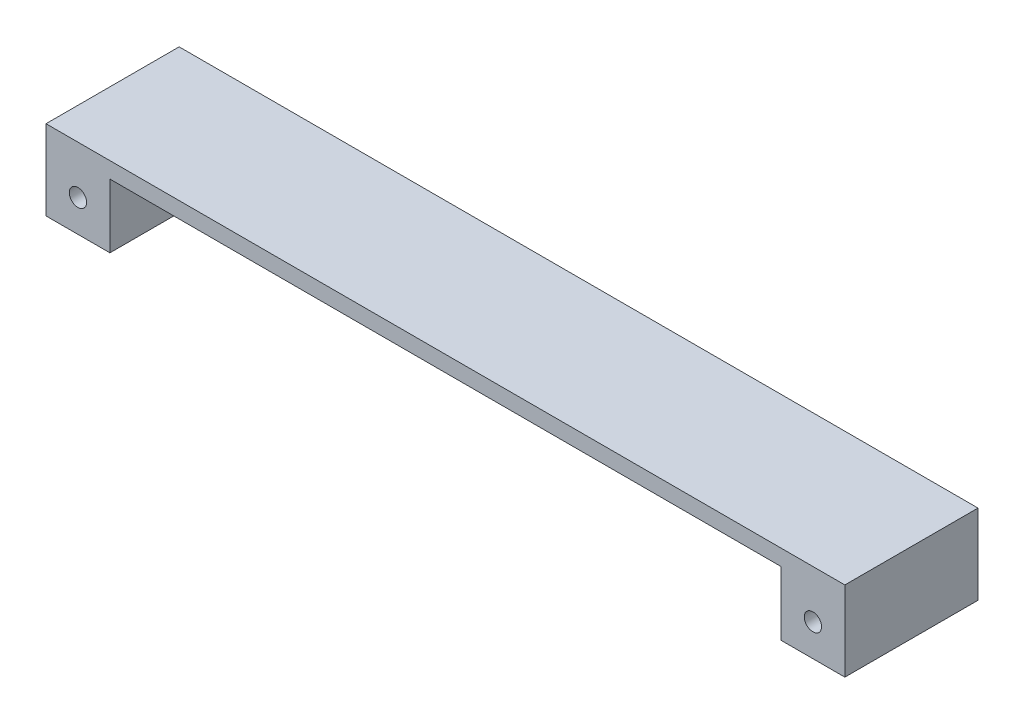
from build123d import *

# Parameters (mm, degrees)
SKETCH1_W           = 150
SKETCH1_H           = 25
BOSS_EXTRUDE1_DEPTH = 3
SKETCH2_W           = 12
SKETCH2_H           = 25
BOSS_EXTRUDE2_DEPTH = 12
SKETCH4_R           = 1.625
CUT_EXTRUDE1_DEPTH  = 153.541797551


with BuildPart() as part:
    # Sketch1 → Boss-Extrude1 (new body)
    with BuildSketch(Plane(origin=(0, 0, 0), x_dir=(1, 0, 0), z_dir=(0, 1, 0))):
        with Locations((75, 12.5)):
            Rectangle(SKETCH1_W, SKETCH1_H)
    extrude(amount=BOSS_EXTRUDE1_DEPTH)

    # Sketch2 → Boss-Extrude2 (add)
    with BuildSketch(Plane.XZ):
        with Locations((6, -12.5)):
            Rectangle(SKETCH2_W, SKETCH2_H)
        with Locations((144, -12.5)):
            Rectangle(SKETCH2_W, SKETCH2_H)
    extrude(amount=BOSS_EXTRUDE2_DEPTH)

    # Sketch4 → Cut-Extrude1 (cut, through all)
    with BuildSketch(Plane.XY):
        with Locations((6, -6)):
            Circle(SKETCH4_R)
        with Locations((144, -6)):
            Circle(SKETCH4_R)
    extrude(amount=-CUT_EXTRUDE1_DEPTH, mode=Mode.SUBTRACT)


solid = part.part
